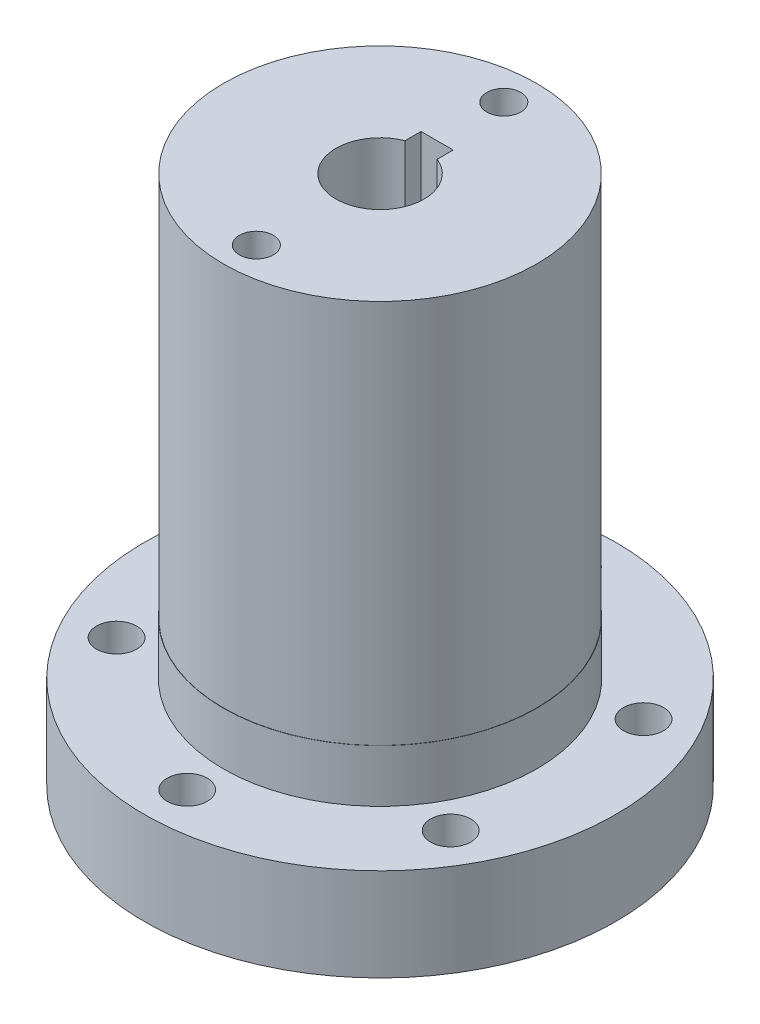
from build123d import *

# Parameters (mm, degrees)
SKETCH1_R           = 25.34
BOSS_EXTRUDE1_DEPTH = 8.5
SKETCH2_R           = 25.3
BOSS_EXTRUDE2_DEPTH = 57.15
SKETCH7_R           = 25.3
BOSS_EXTRUDE4_DEPTH = 15
CUT_EXTRUDE3_DEPTH  = 115
SKETCH6_R           = 38.1
BOSS_EXTRUDE3_DEPTH = 15
SKETCH9_R           = 3.25
CUT_EXTRUDE4_DEPTH  = 20
SKETCH10_R          = 2.75
CUT_EXTRUDE6_DEPTH  = 129
BOSS_EXTRUDE5_START = -93
BOSS_EXTRUDE5_DEPTH = 93
CUT_EXTRUDE8_START  = -10
SKETCH12_R          = 25.3
CUT_EXTRUDE8_DEPTH  = 10
CUT_EXTRUDE9_DEPTH  = 30


with BuildPart() as part:
    # Sketch1 → Boss-Extrude1 (new body)
    with BuildSketch(Plane(origin=(0, 0, 0), x_dir=(1, 0, 0), z_dir=(0, 1, 0))):
        Circle(SKETCH1_R)
    extrude(amount=BOSS_EXTRUDE1_DEPTH)

    # Sketch2 → Boss-Extrude2 (add)
    with BuildSketch(Plane(origin=(0, 8.5, 0), x_dir=(1, 0, 0), z_dir=(0, 1, 0))):
        Circle(SKETCH2_R)
    extrude(amount=BOSS_EXTRUDE2_DEPTH)

    # Sketch7 → Boss-Extrude4 (add)
    with BuildSketch(Plane(origin=(0, 65.65, 0), x_dir=(1, 0, 0), z_dir=(0, 1, 0))):
        Circle(SKETCH7_R)
    extrude(amount=BOSS_EXTRUDE4_DEPTH)

    # Sketch5 → Cut-Extrude3 (cut)
    with BuildSketch(Plane.XZ):
        with BuildLine():
            Line((2.575, 9.15), (-2.575, 9.15))
            Line((-2.575, 9.15), (-2.575, 6.777305881))
            ThreePointArc((-2.575, 6.777305881), (0, -7.25), (2.575, 6.777305881))
            Line((2.575, 6.777305881), (2.575, 9.15))
        make_face()
    extrude(amount=-CUT_EXTRUDE3_DEPTH, mode=Mode.SUBTRACT)

    # Sketch6 → Boss-Extrude3 (add)
    with BuildSketch(Plane.XZ):
        Circle(SKETCH6_R)
    extrude(amount=BOSS_EXTRUDE3_DEPTH)

    # Sketch9 → Cut-Extrude4 (cut)
    with BuildSketch(Plane(origin=(0, 0, 0), x_dir=(1, 0, 0), z_dir=(0, 1, 0))):
        with Locations((0, 31.176914536)):
            Circle(SKETCH9_R)
        with Locations((-27, 15.588457268)):
            Circle(SKETCH9_R)
        with Locations((27, 15.588457268)):
            Circle(SKETCH9_R)
        with Locations((-27, -15.588457268)):
            Circle(SKETCH9_R)
        with Locations((27, -15.588457268)):
            Circle(SKETCH9_R)
        with Locations((0, -31.176914536)):
            Circle(SKETCH9_R)
    extrude(amount=-CUT_EXTRUDE4_DEPTH, mode=Mode.SUBTRACT)

    # Sketch10 → Cut-Extrude6 (cut)
    with BuildSketch(Plane(origin=(0, 80.65, 0), x_dir=(1, 0, 0), z_dir=(0, 1, 0))):
        with Locations((0, 20)):
            Circle(SKETCH10_R)
        with Locations((0, -20)):
            Circle(SKETCH10_R)
    extrude(amount=-CUT_EXTRUDE6_DEPTH, mode=Mode.SUBTRACT)

    # Sketch11 → Boss-Extrude5 (add)
    with BuildSketch(Plane(origin=(0, 80.65, 0), x_dir=(1, 0, 0), z_dir=(0, 1, 0)).offset(BOSS_EXTRUDE5_START)):
        with BuildLine():
            Line((-2.575, -6.777305881), (-2.575, -9.15))
            Line((-2.575, -9.15), (0, -9.15))
            Line((0, -9.15), (2.575, -9.15))
            Line((2.575, -9.15), (2.575, -6.777305881))
            ThreePointArc((2.575, -6.777305881), (0, 7.25), (-2.575, -6.777305881))
        make_face()
    extrude(amount=BOSS_EXTRUDE5_DEPTH)

    # Sketch12 → Cut-Extrude8 (cut)
    with BuildSketch(Plane(origin=(0, 80.65, 0), x_dir=(1, 0, 0), z_dir=(0, 1, 0)).offset(CUT_EXTRUDE8_START)):
        Circle(SKETCH12_R)
    extrude(amount=CUT_EXTRUDE8_DEPTH, mode=Mode.SUBTRACT)

    # Sketch13 → Cut-Extrude9 (cut)
    with BuildSketch(Plane(origin=(0, 70.65, 0), x_dir=(1, 0, 0), z_dir=(0, 1, 0))):
        with BuildLine():
            Line((-2.6, 9.22), (-2.6, 6.62830295))
            ThreePointArc((-2.6, 6.62830295), (0, -7.12), (2.6, 6.62830295))
            Line((2.6, 6.62830295), (2.6, 9.22))
            Line((2.6, 9.22), (-2.6, 9.22))
        make_face()
    extrude(amount=-CUT_EXTRUDE9_DEPTH, mode=Mode.SUBTRACT)


solid = part.part
